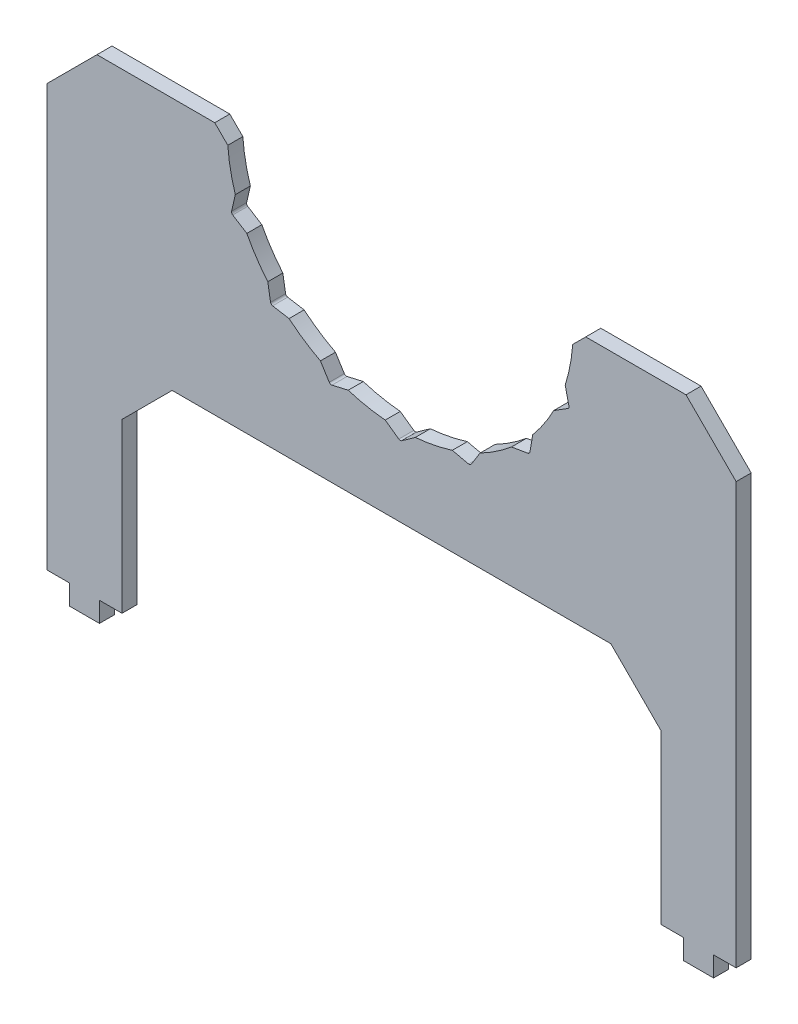
from build123d import *

# Parameters (mm, degrees)
SKETCH1_W           = 137.5
SKETCH1_H           = 98
BOSS_EXTRUDE1_DEPTH = 1.5
SKETCH2_R           = 34
SKETCH2_W           = 107.5
SKETCH2_H           = 47.5
CUT_EXTRUDE1_DEPTH  = 85.478177656
CUT_EXTRUDE3_DEPTH  = 85.478177656
FILLET1_R           = 0.5
SKETCH22_W          = 4.5
SKETCH22_H          = 4
CUT_EXTRUDE5_DEPTH  = 85.478177656
CHAMFER1_SIZE       = 10
CHAMFER2_SIZE       = 2.5


with BuildPart() as part:
    # Sketch1 → Boss-Extrude1 (new, symmetric)
    with BuildSketch(Plane.XY):
        Rectangle(SKETCH1_W, SKETCH1_H)
    extrude(amount=BOSS_EXTRUDE1_DEPTH, both=True)

    # Sketch2 → Cut-Extrude1 (cut, through all)
    with BuildSketch(Plane.XY.offset(1.5)):
        with Locations((1.75, 49)):
            Circle(SKETCH2_R)
        with Locations((0, -25.25)):
            Rectangle(SKETCH2_W, SKETCH2_H)
    extrude(amount=-CUT_EXTRUDE1_DEPTH, mode=Mode.SUBTRACT)

    # Sketch17 → Cut-Extrude3 (cut, through all)
    with BuildSketch(Plane.XY.offset(1.5)):
        with BuildLine():
            Line((1.75, 12.5), (-1.25, 14.630682288))
            ThreePointArc((-1.25, 14.630682288), (-4.98061611, 15.162907826), (-8.630929873, 16.098840522))
            Line((-8.630929873, 16.098840522), (-12.217945281, 15.278397063))
            Line((-12.217945281, 15.278397063), (-14.174207068, 18.394941116))
            ThreePointArc((-14.174207068, 18.394941116), (-17.417173039, 20.314298376), (-20.431457275, 22.575902037))
            Line((-20.431457275, 22.575902037), (-24.059397513, 23.190602487))
            Line((-24.059397513, 23.190602487), (-24.674097963, 26.818542725))
            ThreePointArc((-24.674097963, 26.818542725), (-26.935701624, 29.832826961), (-28.855058884, 33.075792932))
            Line((-28.855058884, 33.075792932), (-31.971602937, 35.032054719))
            Line((-31.971602937, 35.032054719), (-31.151159478, 38.619070127))
            ThreePointArc((-31.151159478, 38.619070127), (1.75, 83.5), (34.651159478, 38.619070127))
            Line((34.651159478, 38.619070127), (35.471602937, 35.032054719))
            Line((35.471602937, 35.032054719), (32.355058884, 33.075792932))
            ThreePointArc((32.355058884, 33.075792932), (30.435701624, 29.832826961), (28.174097963, 26.818542725))
            Line((28.174097963, 26.818542725), (27.559397513, 23.190602487))
            Line((27.559397513, 23.190602487), (23.931457275, 22.575902037))
            ThreePointArc((23.931457275, 22.575902037), (20.917173039, 20.314298376), (17.674207068, 18.394941116))
            Line((17.674207068, 18.394941116), (15.717945281, 15.278397063))
            Line((15.717945281, 15.278397063), (12.130929873, 16.098840522))
            ThreePointArc((12.130929873, 16.098840522), (8.48061611, 15.162907826), (4.75, 14.630682288))
            Line((4.75, 14.630682288), (1.75, 12.5))
        make_face()
    extrude(amount=-CUT_EXTRUDE3_DEPTH, mode=Mode.SUBTRACT)

    # Fillet1
    fillet1_edges = [part.edges().sort_by_distance(p)[0] for p in [
        (15.717945281, 15.278397063, 0),
        (1.75, 12.5, 0),
        (-12.217945281, 15.278397063, 0),
        (-24.059397513, 23.190602487, 0),
        (-31.971602937, 35.032054719, 0),
        (35.471602937, 35.032054719, 0),
        (27.559397513, 23.190602487, 0),
    ]]
    fillet(fillet1_edges, radius=FILLET1_R)

    # Sketch22 → Cut-Extrude5 (cut, through all)
    with BuildSketch(Plane(origin=(0, 0, -1.5), x_dir=(-1, 0, 0), z_dir=(0, 0, -1))):
        with Locations((-66.5, -47)):
            Rectangle(SKETCH22_W, SKETCH22_H)
        with Locations((66.5, -47)):
            Rectangle(SKETCH22_W, SKETCH22_H)
        with Locations((56, -47)):
            Rectangle(SKETCH22_W, SKETCH22_H)
        with Locations((-56, -47)):
            Rectangle(SKETCH22_W, SKETCH22_H)
    extrude(amount=-CUT_EXTRUDE5_DEPTH, mode=Mode.SUBTRACT)

    # Chamfer1
    chamfer1_edges = [part.edges().sort_by_distance(p)[0] for p in [
        (-53.75, -1.5, 0),
        (53.75, -1.5, 0),
        (-68.75, 49, 0),
        (68.75, 49, 0),
    ]]
    chamfer(chamfer1_edges, length=CHAMFER1_SIZE)

    # Chamfer2
    # the kernel refuses this chamfer: 2.5 mm, written as the material it takes off along each edge
    with BuildSketch(Plane(origin=(36.25, 49, -8.184978913), x_dir=(1, 0, 0), z_dir=(0, 0, 1))) as chamfer2_piece_1:
        with BuildLine():
            Line((CHAMFER2_SIZE, 0), (-0.097956106, -2.597956106))
            ThreePointArc((-0.097956106, -2.597956106), (-0.025900977, -1.336598881), (0, 0))
            Line((0, 0), (CHAMFER2_SIZE, 0))
        make_face()
    extrude(amount=16.369957825, mode=Mode.SUBTRACT)
    with BuildSketch(Plane(origin=(-32.75, 49, -8.184978913), x_dir=(-1, 0, 0), z_dir=(0, 0, 1))) as chamfer2_piece_2:
        with BuildLine():
            Line((CHAMFER2_SIZE, 0), (-0.097956106, 2.597956106))
            ThreePointArc((-0.097956106, 2.597956106), (-0.025900977, 1.336598881), (0, 0))
            Line((0, 0), (CHAMFER2_SIZE, 0))
        make_face()
    extrude(amount=16.369957825, mode=Mode.SUBTRACT)


solid = part.part
